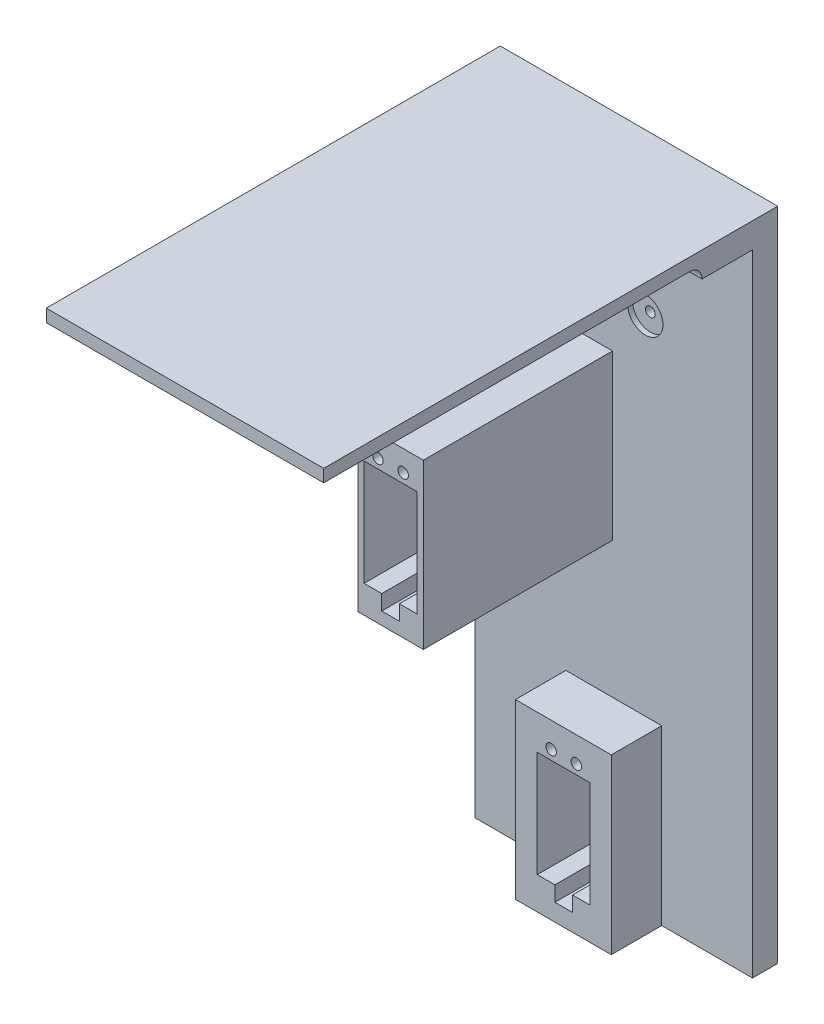
from build123d import *

# Parameters (mm, degrees)
SKETCH1_W           = 150
SKETCH1_H           = 200
BOSS_EXTRUDE1_DEPTH = 30
SKETCH2_W           = 150
SKETCH2_H           = 5
BOSS_EXTRUDE2_DEPTH = 150
SKETCH3_R           = 1.65
CUT_EXTRUDE3_DEPTH  = 80
SKETCH6_R           = 5
CUT_EXTRUDE5_DEPTH  = 22
SKETCH7_R           = 1.925
CUT_EXTRUDE6_DEPTH  = 5
FILLET1_R           = 5
SKETCH9_R           = 2.08
CUT_EXTRUDE7_DEPTH  = 30
BOSS_EXTRUDE5_START = -85
SKETCH12_R          = 2.08
BOSS_EXTRUDE5_DEPTH = 85
SKETCH13_W          = 150
SKETCH13_H          = 60
BOSS_EXTRUDE6_DEPTH = 30
SKETCH15_R          = 2.08
CUT_EXTRUDE8_DEPTH  = 30
SKETCH16_R          = 7
CUT_EXTRUDE9_DEPTH  = 22
SKETCH17_W          = 20
SKETCH17_H          = 260
CUT_EXTRUDE10_DEPTH = 180
SKETCH19_W          = 26
SKETCH19_H          = 65
CUT_EXTRUDE11_DEPTH = 20


with BuildPart() as part:
    # Sketch1 → Boss-Extrude1 (new body)
    with BuildSketch(Plane.XY):
        Rectangle(SKETCH1_W, SKETCH1_H)
    extrude(amount=BOSS_EXTRUDE1_DEPTH)

    # Sketch2 → Boss-Extrude2 (add)
    with BuildSketch(Plane.XY.offset(30)):
        with Locations((0, 97.5)):
            Rectangle(SKETCH2_W, SKETCH2_H)
    extrude(amount=BOSS_EXTRUDE2_DEPTH)

    # Sketch3 → Cut-Extrude3 (cut)
    with BuildSketch(Plane.XY.offset(30)):
        with Locations((-12.5, 46.5)):
            Circle(SKETCH3_R)
        with Locations((12.5, 46.5)):
            Circle(SKETCH3_R)
        with Locations((-12.5, 71.5)):
            Circle(SKETCH3_R)
        with Locations((12.5, 71.5)):
            Circle(SKETCH3_R)
    extrude(amount=-CUT_EXTRUDE3_DEPTH, mode=Mode.SUBTRACT)

    # Sketch6 → Cut-Extrude5 (cut)
    with BuildSketch(Plane.XY.offset(30)):
        with Locations((-12.5, 71.5)):
            Circle(SKETCH6_R)
        with Locations((12.5, 71.5)):
            Circle(SKETCH6_R)
        with Locations((-12.5, 46.5)):
            Circle(SKETCH6_R)
        with Locations((12.5, 46.5)):
            Circle(SKETCH6_R)
    extrude(amount=-CUT_EXTRUDE5_DEPTH, mode=Mode.SUBTRACT)

    # Sketch7 → Cut-Extrude6 (cut)
    with BuildSketch(Plane.XY.offset(8)):
        with Locations((-12.5, 71.5)):
            Circle(SKETCH7_R)
        with Locations((12.5, 71.5)):
            Circle(SKETCH7_R)
        with Locations((-12.5, 46.5)):
            Circle(SKETCH7_R)
        with Locations((12.5, 46.5)):
            Circle(SKETCH7_R)
    extrude(amount=-CUT_EXTRUDE6_DEPTH, mode=Mode.SUBTRACT)

    # Fillet1
    fillet1_edges = [part.edges().sort_by_distance(p)[0] for p in [
        (0, 95, 30),
    ]]
    fillet(fillet1_edges, radius=FILLET1_R)

    # Sketch9 → Cut-Extrude7 (cut)
    with BuildSketch(Plane.XY.offset(30)):
        Polygon((-3, -26.5), (-3, 15.5), (-24, 15.5), (-24, -26.5), (-17, -26.5), (-17, -32.5), (-10, -32.5), (-10, -26.5), align=None)
        with Locations((-8.5, 19.25)):
            Circle(SKETCH9_R)
        with Locations((-18.5, 19.25)):
            Circle(SKETCH9_R)
    extrude(amount=-CUT_EXTRUDE7_DEPTH, mode=Mode.SUBTRACT)

    # Sketch12 → Boss-Extrude5 (add)
    with BuildSketch(Plane(origin=(0, 0, 0), x_dir=(-1, 0, 0), z_dir=(0, 0, -1)).offset(BOSS_EXTRUDE5_START)):
        Polygon((0.5, -37.461410483), (13.5, -37.461410483), (26.5, -37.461410483), (26.5, 27.538589517), (0.5, 27.538589517), align=None)
        Polygon((3, 15.5), (13.5, 15.5), (24, 15.5), (24, -26.5), (17, -26.5), (17, -32.5), (13.5, -32.5), (10, -32.5), (10, -26.5), (3, -26.5), align=None, mode=Mode.SUBTRACT)
        with Locations((8.5, 19.25)):
            Circle(SKETCH12_R, mode=Mode.SUBTRACT)
        with Locations((18.5, 19.25)):
            Circle(SKETCH12_R, mode=Mode.SUBTRACT)
    extrude(amount=BOSS_EXTRUDE5_DEPTH)

    # Sketch13 → Boss-Extrude6 (add)
    with BuildSketch(Plane(origin=(0, 0, 0), x_dir=(-1, 0, 0), z_dir=(0, 0, -1))):
        with Locations((0, -130)):
            Rectangle(SKETCH13_W, SKETCH13_H)
    extrude(amount=-BOSS_EXTRUDE6_DEPTH)

    # Sketch15 → Cut-Extrude8 (cut)
    with BuildSketch(Plane.XY.offset(30)):
        with Locations((-4.843183012, -101.421536398)):
            Circle(SKETCH15_R)
        with Locations((5.156816988, -101.421536398)):
            Circle(SKETCH15_R)
        Polygon((-10.343183012, -105.171536398), (10.656816988, -105.171536398), (10.656816988, -147.171536398), (3.656816988, -147.171536398), (3.656816988, -153.171536398), (-3.343183012, -153.171536398), (-3.343183012, -147.171536398), (-10.343183012, -147.171536398), align=None)
    extrude(amount=-CUT_EXTRUDE8_DEPTH, mode=Mode.SUBTRACT)

    # Sketch16 → Cut-Extrude9 (cut)
    with BuildSketch(Plane.XY.offset(30)):
        with Locations((-12.5, 71.5)):
            Circle(SKETCH16_R)
        with Locations((12.5, 71.5)):
            Circle(SKETCH16_R)
        with Locations((12.5, 46.5)):
            Circle(SKETCH16_R)
        with Locations((-12.5, 46.5)):
            Circle(SKETCH16_R)
    extrude(amount=-CUT_EXTRUDE9_DEPTH, mode=Mode.SUBTRACT)

    # Sketch17 → Cut-Extrude10 (cut)
    with BuildSketch(Plane(origin=(0, 0, 0), x_dir=(-1, 0, 0), z_dir=(0, 0, -1))):
        with Locations((65, -30)):
            Rectangle(SKETCH17_W, SKETCH17_H)
        with Locations((-65, -30)):
            Rectangle(SKETCH17_W, SKETCH17_H)
    extrude(amount=-CUT_EXTRUDE10_DEPTH, mode=Mode.SUBTRACT)

    # Sketch19 → Cut-Extrude11 (cut)
    with BuildSketch(Plane.XY.offset(30)):
        Polygon((-55, 90), (55, 90), (55, -160), (19, -160), (19, -91.388207499), (-19, -91.388207499), (-19, -160), (-55, -160), align=None)
        with Locations((-13.5, -4.961410483)):
            Rectangle(SKETCH19_W, SKETCH19_H, mode=Mode.SUBTRACT)
    extrude(amount=-CUT_EXTRUDE11_DEPTH, mode=Mode.SUBTRACT)


solid = part.part
